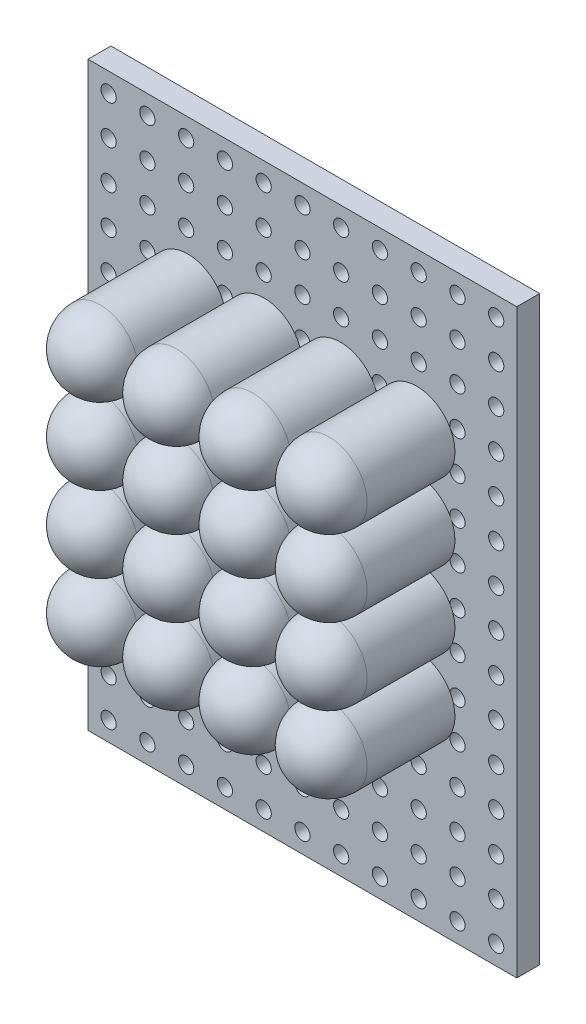
from build123d import *

# Parameters (mm, degrees)
SKETCH1_W               = 28.1
SKETCH1_H               = 38.1
BOSS_EXTRUDE1_DEPTH     = 1.5
FILL_PATTERN1_OUTLINE_R = 0.5
FILL_PATTERN1_DEPTH     = 1.5
SKETCH3_R               = 2.495
BOSS_EXTRUDE2_DEPTH     = 8.25
FILLET1_R               = 2.495
LPATTERN2_COUNT         = 4
LPATTERN2_PITCH         = 5
LPATTERN2_COUNT_DIR2    = 4
LPATTERN2_PITCH_DIR2    = 5
FILLET1_OF_LPATTERN2_R  = 2.495


# Read off the part's stored shape, not the designer's step: Fill Pattern1
with BuildPart() as part:
    # Sketch1 → Boss-Extrude1 (new body)
    with BuildSketch(Plane.XY):
        Rectangle(SKETCH1_W, SKETCH1_H)
    extrude(amount=BOSS_EXTRUDE1_DEPTH)

    # Fill Pattern1 outline → Fill Pattern1 (cut)
    with BuildSketch(Plane.XY):
        Circle(FILL_PATTERN1_OUTLINE_R)
        with Locations((5.08, -17.78)):
            Circle(FILL_PATTERN1_OUTLINE_R)
        with Locations((-12.7, -2.54)):
            Circle(FILL_PATTERN1_OUTLINE_R)
        with Locations((-10.16, -15.24)):
            Circle(FILL_PATTERN1_OUTLINE_R)
        with Locations((2.54, -17.78)):
            Circle(FILL_PATTERN1_OUTLINE_R)
        with Locations((-7.62, -15.24)):
            Circle(FILL_PATTERN1_OUTLINE_R)
        with Locations((-12.7, -5.08)):
            Circle(FILL_PATTERN1_OUTLINE_R)
        with Locations((7.62, -17.78)):
            Circle(FILL_PATTERN1_OUTLINE_R)
        with Locations((-5.08, -15.24)):
            Circle(FILL_PATTERN1_OUTLINE_R)
        with Locations((-2.54, -17.78)):
            Circle(FILL_PATTERN1_OUTLINE_R)
        with Locations((-12.7, 5.08)):
            Circle(FILL_PATTERN1_OUTLINE_R)
        with Locations((-5.08, -17.78)):
            Circle(FILL_PATTERN1_OUTLINE_R)
        with Locations((-12.7, 7.62)):
            Circle(FILL_PATTERN1_OUTLINE_R)
        with Locations((-12.7, 0)):
            Circle(FILL_PATTERN1_OUTLINE_R)
        with Locations((-12.7, -15.24)):
            Circle(FILL_PATTERN1_OUTLINE_R)
        with Locations((0, -17.78)):
            Circle(FILL_PATTERN1_OUTLINE_R)
        with Locations((-12.7, 2.54)):
            Circle(FILL_PATTERN1_OUTLINE_R)
        with Locations((-10.16, 2.54)):
            Circle(FILL_PATTERN1_OUTLINE_R)
        with Locations((-10.16, -12.7)):
            Circle(FILL_PATTERN1_OUTLINE_R)
        with Locations((2.54, -15.24)):
            Circle(FILL_PATTERN1_OUTLINE_R)
        with Locations((-10.16, 5.08)):
            Circle(FILL_PATTERN1_OUTLINE_R)
        with Locations((7.62, -15.24)):
            Circle(FILL_PATTERN1_OUTLINE_R)
        with Locations((-10.16, 0)):
            Circle(FILL_PATTERN1_OUTLINE_R)
        with Locations((-7.62, -12.7)):
            Circle(FILL_PATTERN1_OUTLINE_R)
        with Locations((5.08, -15.24)):
            Circle(FILL_PATTERN1_OUTLINE_R)
        with Locations((-12.7, -10.16)):
            Circle(FILL_PATTERN1_OUTLINE_R)
        with Locations((-2.54, -15.24)):
            Circle(FILL_PATTERN1_OUTLINE_R)
        with Locations((10.16, -17.78)):
            Circle(FILL_PATTERN1_OUTLINE_R)
        with Locations((-12.7, -7.62)):
            Circle(FILL_PATTERN1_OUTLINE_R)
        with Locations((-12.7, -12.7)):
            Circle(FILL_PATTERN1_OUTLINE_R)
        with Locations((0, -15.24)):
            Circle(FILL_PATTERN1_OUTLINE_R)
        with Locations((12.7, -17.78)):
            Circle(FILL_PATTERN1_OUTLINE_R)
        with Locations((-10.16, 7.62)):
            Circle(FILL_PATTERN1_OUTLINE_R)
        with Locations((-12.7, -17.78)):
            Circle(FILL_PATTERN1_OUTLINE_R)
        with Locations((-10.16, -17.78)):
            Circle(FILL_PATTERN1_OUTLINE_R)
        with Locations((-12.7, 10.16)):
            Circle(FILL_PATTERN1_OUTLINE_R)
        with Locations((-7.62, -17.78)):
            Circle(FILL_PATTERN1_OUTLINE_R)
        with Locations((5.08, 0)):
            Circle(FILL_PATTERN1_OUTLINE_R)
        with Locations((7.62, 7.62)):
            Circle(FILL_PATTERN1_OUTLINE_R)
        with Locations((5.08, 10.16)):
            Circle(FILL_PATTERN1_OUTLINE_R)
        with Locations((2.54, 12.7)):
            Circle(FILL_PATTERN1_OUTLINE_R)
        with Locations((0, 15.24)):
            Circle(FILL_PATTERN1_OUTLINE_R)
        with Locations((-2.54, 17.78)):
            Circle(FILL_PATTERN1_OUTLINE_R)
        with Locations((-2.54, 0)):
            Circle(FILL_PATTERN1_OUTLINE_R)
        with Locations((5.08, -2.54)):
            Circle(FILL_PATTERN1_OUTLINE_R)
        with Locations((0, -2.54)):
            Circle(FILL_PATTERN1_OUTLINE_R)
        with Locations((5.08, 2.54)):
            Circle(FILL_PATTERN1_OUTLINE_R)
        with Locations((5.08, 7.62)):
            Circle(FILL_PATTERN1_OUTLINE_R)
        with Locations((2.54, 10.16)):
            Circle(FILL_PATTERN1_OUTLINE_R)
        with Locations((-2.54, -2.54)):
            Circle(FILL_PATTERN1_OUTLINE_R)
        with Locations((-5.08, 17.78)):
            Circle(FILL_PATTERN1_OUTLINE_R)
        with Locations((-2.54, 15.24)):
            Circle(FILL_PATTERN1_OUTLINE_R)
        with Locations((0, 12.7)):
            Circle(FILL_PATTERN1_OUTLINE_R)
        with Locations((7.62, 12.7)):
            Circle(FILL_PATTERN1_OUTLINE_R)
        with Locations((5.08, 15.24)):
            Circle(FILL_PATTERN1_OUTLINE_R)
        with Locations((2.54, 17.78)):
            Circle(FILL_PATTERN1_OUTLINE_R)
        with Locations((2.54, -5.08)):
            Circle(FILL_PATTERN1_OUTLINE_R)
        with Locations((7.62, 0)):
            Circle(FILL_PATTERN1_OUTLINE_R)
        with Locations((10.16, 7.62)):
            Circle(FILL_PATTERN1_OUTLINE_R)
        with Locations((10.16, 12.7)):
            Circle(FILL_PATTERN1_OUTLINE_R)
        with Locations((7.62, 15.24)):
            Circle(FILL_PATTERN1_OUTLINE_R)
        with Locations((7.62, 5.08)):
            Circle(FILL_PATTERN1_OUTLINE_R)
        with Locations((7.62, 10.16)):
            Circle(FILL_PATTERN1_OUTLINE_R)
        with Locations((5.08, 12.7)):
            Circle(FILL_PATTERN1_OUTLINE_R)
        with Locations((2.54, 15.24)):
            Circle(FILL_PATTERN1_OUTLINE_R)
        with Locations((0, 17.78)):
            Circle(FILL_PATTERN1_OUTLINE_R)
        with Locations((5.08, -5.08)):
            Circle(FILL_PATTERN1_OUTLINE_R)
        with Locations((7.62, 2.54)):
            Circle(FILL_PATTERN1_OUTLINE_R)
        with Locations((10.16, 10.16)):
            Circle(FILL_PATTERN1_OUTLINE_R)
        with Locations((2.54, 2.54)):
            Circle(FILL_PATTERN1_OUTLINE_R)
        with Locations((-12.7, 15.24)):
            Circle(FILL_PATTERN1_OUTLINE_R)
        with Locations((-10.16, 12.7)):
            Circle(FILL_PATTERN1_OUTLINE_R)
        with Locations((-7.62, 10.16)):
            Circle(FILL_PATTERN1_OUTLINE_R)
        with Locations((0, 5.08)):
            Circle(FILL_PATTERN1_OUTLINE_R)
        with Locations((-2.54, 7.62)):
            Circle(FILL_PATTERN1_OUTLINE_R)
        with Locations((-5.08, 10.16)):
            Circle(FILL_PATTERN1_OUTLINE_R)
        with Locations((-7.62, 12.7)):
            Circle(FILL_PATTERN1_OUTLINE_R)
        with Locations((-2.54, 2.54)):
            Circle(FILL_PATTERN1_OUTLINE_R)
        with Locations((-5.08, 5.08)):
            Circle(FILL_PATTERN1_OUTLINE_R)
        with Locations((-7.62, 7.62)):
            Circle(FILL_PATTERN1_OUTLINE_R)
        with Locations((-10.16, 10.16)):
            Circle(FILL_PATTERN1_OUTLINE_R)
        with Locations((-5.08, 7.62)):
            Circle(FILL_PATTERN1_OUTLINE_R)
        with Locations((-2.54, 5.08)):
            Circle(FILL_PATTERN1_OUTLINE_R)
        with Locations((0, 2.54)):
            Circle(FILL_PATTERN1_OUTLINE_R)
        with Locations((-12.7, 12.7)):
            Circle(FILL_PATTERN1_OUTLINE_R)
        with Locations((2.54, 7.62)):
            Circle(FILL_PATTERN1_OUTLINE_R)
        with Locations((5.08, 5.08)):
            Circle(FILL_PATTERN1_OUTLINE_R)
        with Locations((2.54, -2.54)):
            Circle(FILL_PATTERN1_OUTLINE_R)
        with Locations((-10.16, 17.78)):
            Circle(FILL_PATTERN1_OUTLINE_R)
        with Locations((0, 10.16)):
            Circle(FILL_PATTERN1_OUTLINE_R)
        with Locations((-2.54, 12.7)):
            Circle(FILL_PATTERN1_OUTLINE_R)
        with Locations((-5.08, 15.24)):
            Circle(FILL_PATTERN1_OUTLINE_R)
        with Locations((-7.62, 17.78)):
            Circle(FILL_PATTERN1_OUTLINE_R)
        with Locations((-10.16, 15.24)):
            Circle(FILL_PATTERN1_OUTLINE_R)
        with Locations((-12.7, 17.78)):
            Circle(FILL_PATTERN1_OUTLINE_R)
        with Locations((2.54, 0)):
            Circle(FILL_PATTERN1_OUTLINE_R)
        with Locations((2.54, 5.08)):
            Circle(FILL_PATTERN1_OUTLINE_R)
        with Locations((0, 7.62)):
            Circle(FILL_PATTERN1_OUTLINE_R)
        with Locations((-2.54, 10.16)):
            Circle(FILL_PATTERN1_OUTLINE_R)
        with Locations((-5.08, 12.7)):
            Circle(FILL_PATTERN1_OUTLINE_R)
        with Locations((-7.62, 15.24)):
            Circle(FILL_PATTERN1_OUTLINE_R)
        with Locations((2.54, -10.16)):
            Circle(FILL_PATTERN1_OUTLINE_R)
        with Locations((12.7, -10.16)):
            Circle(FILL_PATTERN1_OUTLINE_R)
        with Locations((-7.62, -2.54)):
            Circle(FILL_PATTERN1_OUTLINE_R)
        with Locations((0, -10.16)):
            Circle(FILL_PATTERN1_OUTLINE_R)
        with Locations((10.16, -12.7)):
            Circle(FILL_PATTERN1_OUTLINE_R)
        with Locations((-2.54, -10.16)):
            Circle(FILL_PATTERN1_OUTLINE_R)
        with Locations((-7.62, 0)):
            Circle(FILL_PATTERN1_OUTLINE_R)
        with Locations((12.7, -12.7)):
            Circle(FILL_PATTERN1_OUTLINE_R)
        with Locations((12.7, -5.08)):
            Circle(FILL_PATTERN1_OUTLINE_R)
        with Locations((7.62, -10.16)):
            Circle(FILL_PATTERN1_OUTLINE_R)
        with Locations((-5.08, -7.62)):
            Circle(FILL_PATTERN1_OUTLINE_R)
        with Locations((12.7, -2.54)):
            Circle(FILL_PATTERN1_OUTLINE_R)
        with Locations((-7.62, -5.08)):
            Circle(FILL_PATTERN1_OUTLINE_R)
        with Locations((12.7, -7.62)):
            Circle(FILL_PATTERN1_OUTLINE_R)
        with Locations((5.08, -10.16)):
            Circle(FILL_PATTERN1_OUTLINE_R)
        with Locations((-7.62, -7.62)):
            Circle(FILL_PATTERN1_OUTLINE_R)
        with Locations((-10.16, -5.08)):
            Circle(FILL_PATTERN1_OUTLINE_R)
        with Locations((12.7, -15.24)):
            Circle(FILL_PATTERN1_OUTLINE_R)
        with Locations((0, -12.7)):
            Circle(FILL_PATTERN1_OUTLINE_R)
        with Locations((-10.16, -7.62)):
            Circle(FILL_PATTERN1_OUTLINE_R)
        with Locations((-2.54, -12.7)):
            Circle(FILL_PATTERN1_OUTLINE_R)
        with Locations((10.16, -15.24)):
            Circle(FILL_PATTERN1_OUTLINE_R)
        with Locations((-10.16, -2.54)):
            Circle(FILL_PATTERN1_OUTLINE_R)
        with Locations((-5.08, -12.7)):
            Circle(FILL_PATTERN1_OUTLINE_R)
        with Locations((-7.62, 5.08)):
            Circle(FILL_PATTERN1_OUTLINE_R)
        with Locations((7.62, -12.7)):
            Circle(FILL_PATTERN1_OUTLINE_R)
        with Locations((-5.08, -10.16)):
            Circle(FILL_PATTERN1_OUTLINE_R)
        with Locations((-7.62, 2.54)):
            Circle(FILL_PATTERN1_OUTLINE_R)
        with Locations((2.54, -12.7)):
            Circle(FILL_PATTERN1_OUTLINE_R)
        with Locations((-10.16, -10.16)):
            Circle(FILL_PATTERN1_OUTLINE_R)
        with Locations((5.08, -12.7)):
            Circle(FILL_PATTERN1_OUTLINE_R)
        with Locations((-7.62, -10.16)):
            Circle(FILL_PATTERN1_OUTLINE_R)
        with Locations((7.62, -5.08)):
            Circle(FILL_PATTERN1_OUTLINE_R)
        with Locations((10.16, 2.54)):
            Circle(FILL_PATTERN1_OUTLINE_R)
        with Locations((12.7, 10.16)):
            Circle(FILL_PATTERN1_OUTLINE_R)
        with Locations((12.7, 15.24)):
            Circle(FILL_PATTERN1_OUTLINE_R)
        with Locations((10.16, 0)):
            Circle(FILL_PATTERN1_OUTLINE_R)
        with Locations((7.62, -7.62)):
            Circle(FILL_PATTERN1_OUTLINE_R)
        with Locations((-5.08, -5.08)):
            Circle(FILL_PATTERN1_OUTLINE_R)
        with Locations((10.16, 17.78)):
            Circle(FILL_PATTERN1_OUTLINE_R)
        with Locations((5.08, 17.78)):
            Circle(FILL_PATTERN1_OUTLINE_R)
        with Locations((0, -5.08)):
            Circle(FILL_PATTERN1_OUTLINE_R)
        with Locations((7.62, -2.54)):
            Circle(FILL_PATTERN1_OUTLINE_R)
        with Locations((10.16, 5.08)):
            Circle(FILL_PATTERN1_OUTLINE_R)
        with Locations((12.7, 12.7)):
            Circle(FILL_PATTERN1_OUTLINE_R)
        with Locations((10.16, 15.24)):
            Circle(FILL_PATTERN1_OUTLINE_R)
        with Locations((7.62, 17.78)):
            Circle(FILL_PATTERN1_OUTLINE_R)
        with Locations((-2.54, -5.08)):
            Circle(FILL_PATTERN1_OUTLINE_R)
        with Locations((10.16, -5.08)):
            Circle(FILL_PATTERN1_OUTLINE_R)
        with Locations((12.7, 2.54)):
            Circle(FILL_PATTERN1_OUTLINE_R)
        with Locations((-5.08, 2.54)):
            Circle(FILL_PATTERN1_OUTLINE_R)
        with Locations((0, -7.62)):
            Circle(FILL_PATTERN1_OUTLINE_R)
        with Locations((10.16, -10.16)):
            Circle(FILL_PATTERN1_OUTLINE_R)
        with Locations((-2.54, -7.62)):
            Circle(FILL_PATTERN1_OUTLINE_R)
        with Locations((12.7, 0)):
            Circle(FILL_PATTERN1_OUTLINE_R)
        with Locations((10.16, -7.62)):
            Circle(FILL_PATTERN1_OUTLINE_R)
        with Locations((12.7, 7.62)):
            Circle(FILL_PATTERN1_OUTLINE_R)
        with Locations((12.7, 17.78)):
            Circle(FILL_PATTERN1_OUTLINE_R)
        with Locations((-5.08, -2.54)):
            Circle(FILL_PATTERN1_OUTLINE_R)
        with Locations((5.08, -7.62)):
            Circle(FILL_PATTERN1_OUTLINE_R)
        with Locations((10.16, -2.54)):
            Circle(FILL_PATTERN1_OUTLINE_R)
        with Locations((12.7, 5.08)):
            Circle(FILL_PATTERN1_OUTLINE_R)
        with Locations((-5.08, 0)):
            Circle(FILL_PATTERN1_OUTLINE_R)
        with Locations((2.54, -7.62)):
            Circle(FILL_PATTERN1_OUTLINE_R)
    extrude(amount=FILL_PATTERN1_DEPTH, mode=Mode.SUBTRACT)

    # Sketch3 → Boss-Extrude2 (add)
    with BuildSketch(Plane.XY.offset(1.5)):
        with Locations(Location((-7.5, 8.77, 0), (0, 0, 197.069345546))):
            Circle(SKETCH3_R)
    boss_extrude2 = extrude(amount=BOSS_EXTRUDE2_DEPTH)

    # Fillet1
    fillet1_edges = [part.edges().sort_by_distance(p)[0] for p in [
        (-5.114904262, 9.50235464, 9.75),
    ]]
    fillet(fillet1_edges, radius=FILLET1_R)

    # LPattern2: Boss-Extrude2 4 × 4
    with Locations(*[(i * LPATTERN2_PITCH, -j * LPATTERN2_PITCH_DIR2, 0) for i in range(LPATTERN2_COUNT) for j in range(LPATTERN2_COUNT_DIR2) if (i, j) != (0, 0)]):
        add(boss_extrude2)

    # Fillet1 of LPattern2
    fillet1_of_lpattern2_edges = [part.edges().sort_by_distance(p)[0] for p in [
        (-5.114904262, 4.50235464, 9.75),
        (-5.114904262, -0.49764536, 9.75),
        (-5.114904262, -5.49764536, 9.75),
        (-0.114904262, 9.50235464, 9.75),
        (-0.114904262, 4.50235464, 9.75),
        (-0.114904262, -0.49764536, 9.75),
        (-0.114904262, -5.49764536, 9.75),
        (4.885095738, 9.50235464, 9.75),
        (4.885095738, 4.50235464, 9.75),
        (4.885095738, -0.49764536, 9.75),
        (4.885095738, -5.49764536, 9.75),
        (9.885095738, 9.50235464, 9.75),
        (9.885095738, 4.50235464, 9.75),
        (9.885095738, -0.49764536, 9.75),
        (9.885095738, -5.49764536, 9.75),
    ]]
    fillet(fillet1_of_lpattern2_edges, radius=FILLET1_OF_LPATTERN2_R)


solid = part.part
